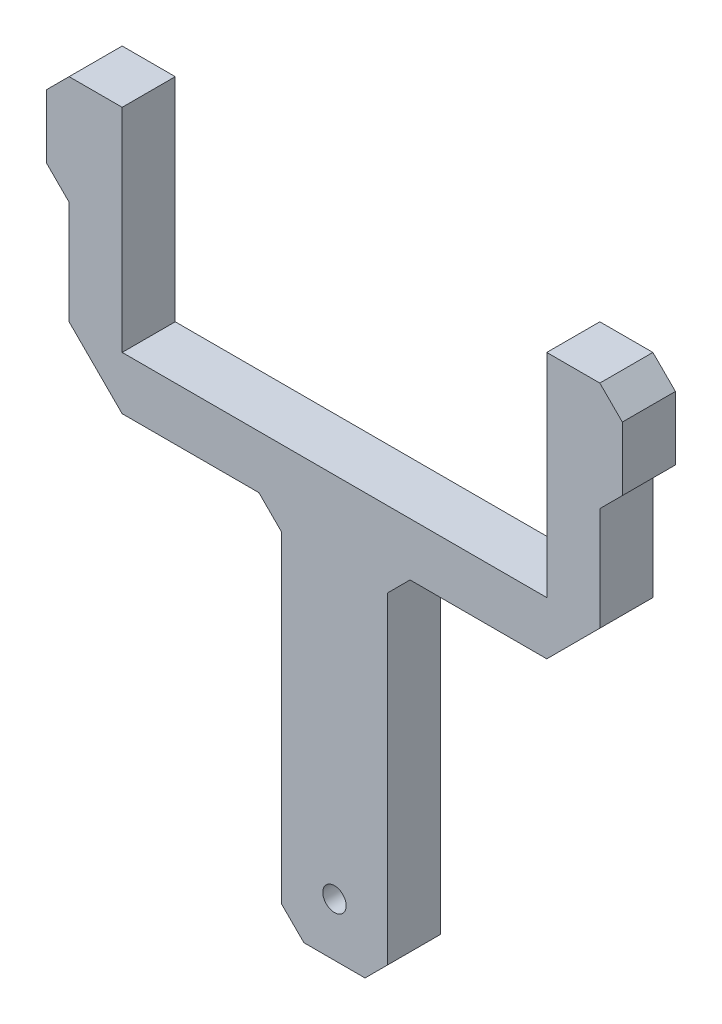
from build123d import *

# Parameters (mm, degrees)
CROQUIS1_R              = 1.1
SALIENTE_EXTRUIR1_DEPTH = 5
CORTAR_EXTRUIR1_DEPTH   = 62.169649477


with BuildPart() as part:
    # Croquis1 → Saliente-Extruir1 (new body)
    with BuildSketch(Plane.XY):
        Polygon((-5, 27.478679656), (-5, -5), (5, -5), (5, 27.478679656), (7.121320344, 29.6), (20.002640687, 29.6), (25, 34.597359313), (25, 44.357359313), (27.121320344, 46.478679656), (27.121320344, 52.478679656), (25, 54.6), (20, 54.6), (20, 34.6), (-20, 34.6), (-20, 54.6), (-25, 54.6), (-27.121320344, 52.478679656), (-27.121320344, 46.478679656), (-25, 44.357359313), (-25, 34.597359313), (-20.002640687, 29.6), (-7.121320344, 29.6), align=None)
        Circle(CROQUIS1_R, mode=Mode.SUBTRACT)
    extrude(amount=SALIENTE_EXTRUIR1_DEPTH)

    # Croquis2 → Cortar-Extruir1 (cut, through all)
    with BuildSketch(Plane(origin=(0, 0, 0), x_dir=(-1, 0, 0), z_dir=(0, 0, -1))):
        Polygon((-5, -5), (-2.878679656, -5), (-5, -2.878679656), align=None)
        Polygon((2.878679656, -5), (5, -2.878679656), (5, -5), align=None)
    extrude(amount=-CORTAR_EXTRUIR1_DEPTH, mode=Mode.SUBTRACT)


solid = part.part
